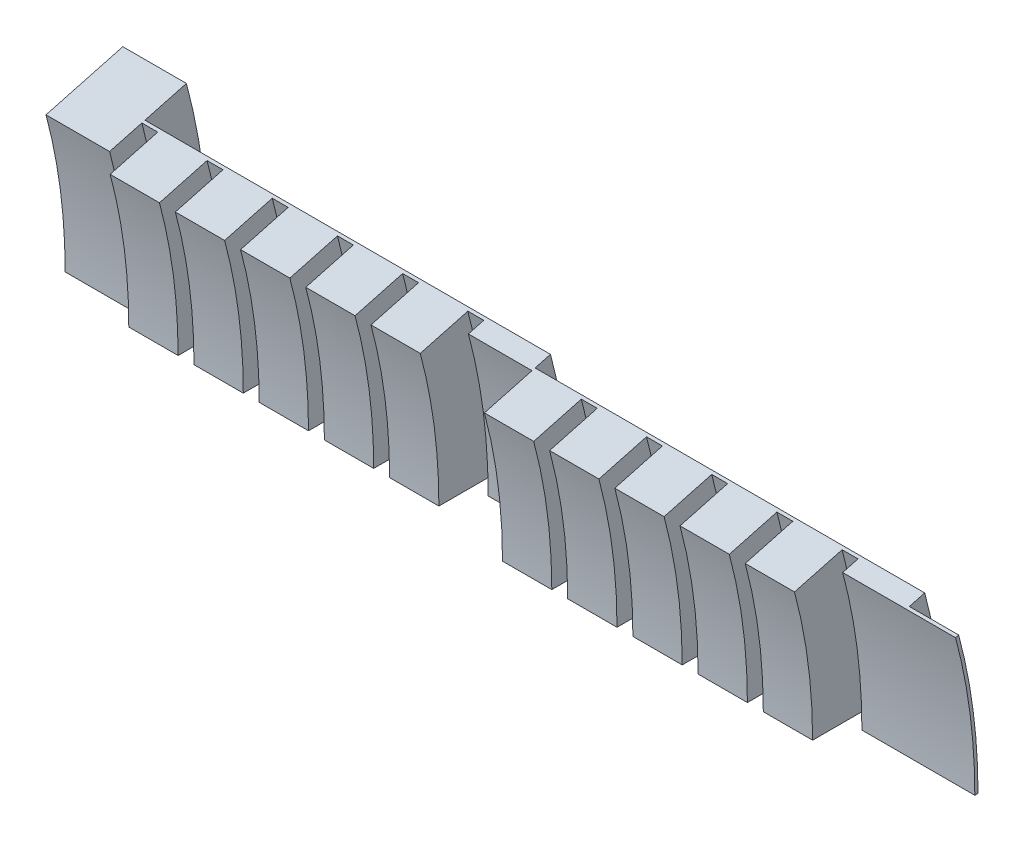
from build123d import *

# Parameters (mm, degrees)
REVOLVE1_ANGLE = 15


with BuildPart() as part:
    # Sketch1 → Revolve1 (revolve)
    with BuildSketch(Plane(origin=(0, 0, 0), x_dir=(1, 0, 0), z_dir=(0, 1, 0))):
        Polygon((0.254, 9.525), (0.254, 8.7376), (1.0414, 8.7376), (1.0414, 9.525), (1.2954, 9.525), (1.2954, 8.7376), (2.0828, 8.7376), (2.0828, 9.525), (2.3368, 9.525), (2.3368, 8.7376), (3.1242, 8.7376), (3.1242, 9.525), (3.3782, 9.525), (3.3782, 8.7376), (4.1656, 8.7376), (4.1656, 9.525), (4.4196, 9.525), (4.4196, 8.7376), (5.207, 8.7376), (5.207, 9.525), (5.461, 9.525), (5.461, 9.271), (6.477, 9.271), (6.477, 8.4836), (7.2644, 8.4836), (7.2644, 9.271), (7.5184, 9.271), (7.5184, 8.4836), (8.3058, 8.4836), (8.3058, 9.271), (8.5598, 9.271), (8.5598, 8.4836), (9.3472, 8.4836), (9.3472, 9.271), (9.6012, 9.271), (9.6012, 8.4836), (10.3886, 8.4836), (10.3886, 9.271), (10.6426, 9.271), (10.6426, 8.4836), (11.43, 8.4836), (11.43, 9.271), (11.684, 9.271), (11.684, 9.017), (12.7, 9.017), (13.4874, 9.017), (13.4874, 9.0678), (12.7, 9.0678), (12.7, 9.3218), (6.477, 9.3218), (6.477, 9.5758), (0, 9.5758), (0, 10.2616), (-1.016, 10.2616), (-1.016, 8.9916), (0, 8.9916), (0, 9.525), align=None)
    revolve(axis=Axis((0, 0, 0), (1, 0, 0)), revolution_arc=REVOLVE1_ANGLE)


solid = part.part
